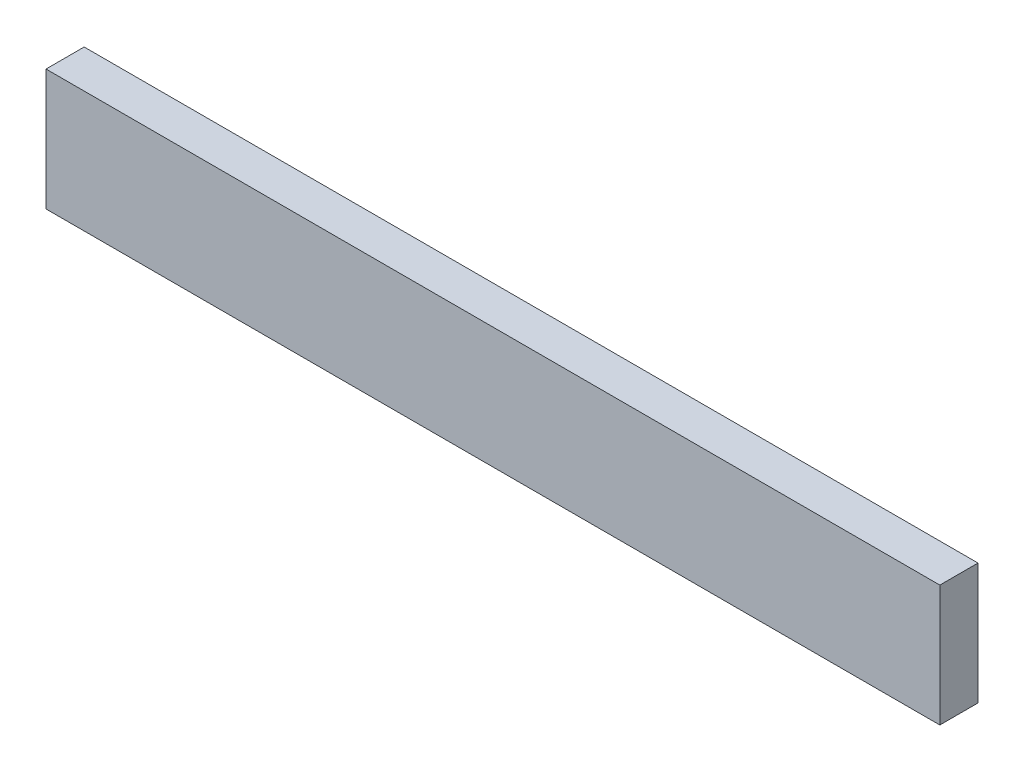
from build123d import *

# Parameters (mm, degrees)
SKETCH1_W           = 37.465
SKETCH1_H           = 5.08
BOSS_EXTRUDE1_DEPTH = 1.6


with BuildPart() as part:
    # Sketch1 → Boss-Extrude1 (new body)
    with BuildSketch(Plane.XY):
        Rectangle(SKETCH1_W, SKETCH1_H)
    extrude(amount=BOSS_EXTRUDE1_DEPTH)


solid = part.part
